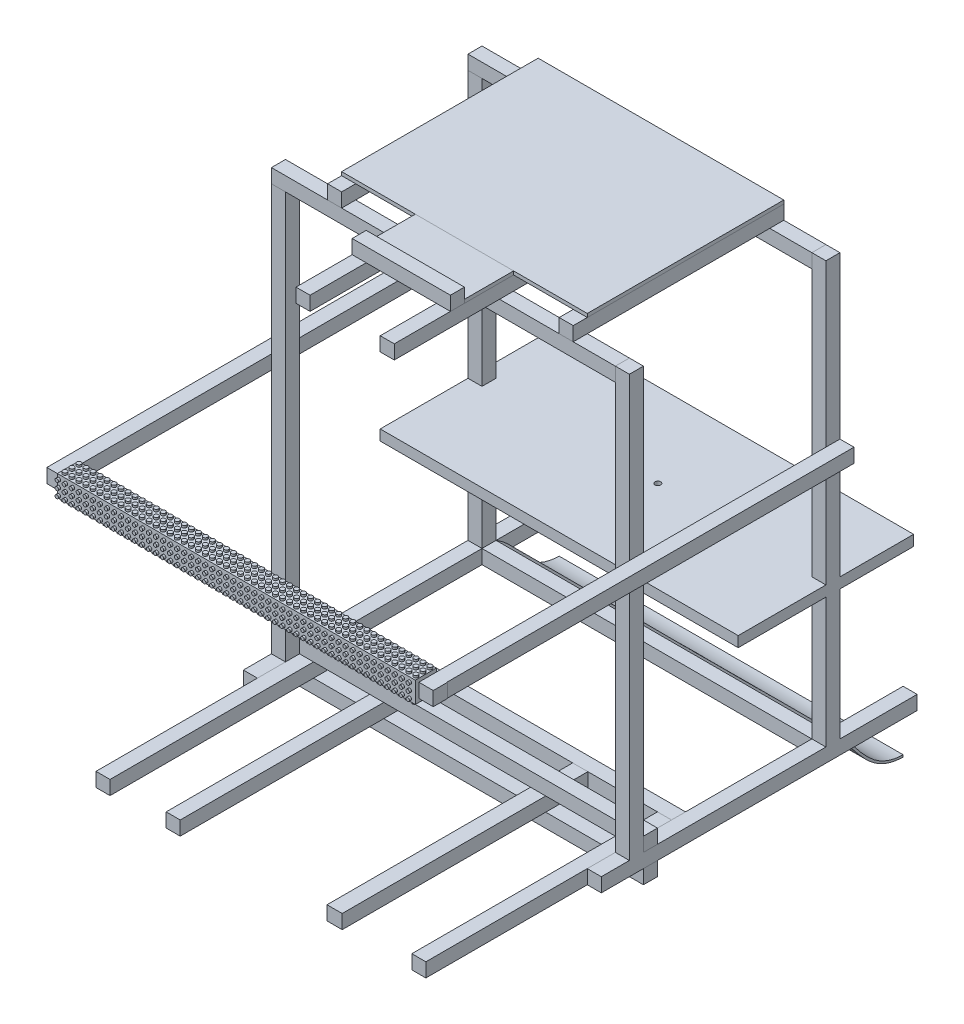
from build123d import *

# Parameters (mm, degrees)
SKETCH1_W                  = 20
SKETCH1_H                  = 20
BOSS_EXTRUDE1_DEPTH        = 450
BOSS_EXTRUDE1_2_DEPTH      = 450
SKETCH3_W                  = 20
SKETCH3_H                  = 20
BOSS_EXTRUDE2_DEPTH        = 600
BOSS_EXTRUDE2_2_DEPTH      = 600
SKETCH5_W                  = 20
SKETCH5_H                  = 20
BOSS_EXTRUDE3_DEPTH        = 600
SKETCH6_W                  = 20
SKETCH6_H                  = 20
BOSS_EXTRUDE4_DEPTH        = 470
SKETCH7_W                  = 20
SKETCH7_H                  = 20
BOSS_EXTRUDE5_DEPTH        = 350
SKETCH7_W_2                = 21.587597794
BOSS_EXTRUDE5_2_DEPTH      = 350
BOSS_EXTRUDE5_3_DEPTH      = 350
BOSS_EXTRUDE5_4_DEPTH      = 350
SKETCH8_W                  = 20
SKETCH8_H                  = 20
BOSS_EXTRUDE6_DEPTH        = 470
BOSS_EXTRUDE7_DEPTH        = 500
BOSS_EXTRUDE7_DEPTH_BACK   = 10
SKETCH9_W                  = 20
SKETCH9_H                  = 20
BOSS_EXTRUDE7_2_DEPTH      = 500
BOSS_EXTRUDE7_2_DEPTH_BACK = 10
SKETCH10_W                 = 20
SKETCH10_H                 = 20
BOSS_EXTRUDE9_DEPTH        = 490
BOSS_EXTRUDE9_2_DEPTH      = 490
SKETCH11_W                 = 20
SKETCH11_H                 = 20
BOSS_EXTRUDE10_DEPTH       = 300
BOSS_EXTRUDE10_2_DEPTH     = 300
SKETCH11_3_W               = 20
SKETCH11_3_H               = 20
BOSS_EXTRUDE11_DEPTH       = 450
BOSS_EXTRUDE11_2_DEPTH     = 450
SKETCH12_W                 = 20
SKETCH12_H                 = 20
BOSS_EXTRUDE12_DEPTH       = 140
SKETCH13_W                 = 20
SKETCH13_H                 = 20
BOSS_EXTRUDE13_DEPTH       = 600
BOSS_EXTRUDE13_2_DEPTH     = 600
SKETCH14_W                 = 70
SKETCH14_H                 = 5
BOSS_EXTRUDE14_DEPTH       = 140
SKETCH16_W                 = 350
SKETCH16_H                 = 5
BOSS_EXTRUDE15_DEPTH       = 280
SKETCH18_R                 = 5
CUT_EXTRUDE1_DEPTH         = 20
BOSS_EXTRUDE17_DEPTH       = 490
BOSS_EXTRUDE18_START       = -510
SKETCH23_W                 = 250
SKETCH23_H                 = 15
BOSS_EXTRUDE18_DEPTH       = 510
SKETCH24_R                 = 4
CUT_EXTRUDE2_DEPTH         = 15
SKETCH25_W                 = 550.536988499
SKETCH25_H                 = 20
BOSS_EXTRUDE19_DEPTH       = 20
SKETCH26_W                 = 30
SKETCH26_H                 = 30
SKETCH26_W_2               = 20
SKETCH26_H_2               = 20
BOSS_EXTRUDE20_DEPTH       = 510
SKETCH27_R                 = 2.31294086
BOSS_EXTRUDE21_DEPTH       = 4
LPATTERN1_COUNT            = 51
LPATTERN1_PITCH            = 10
LPATTERN1_COUNT_DIR2       = 3
LPATTERN1_PITCH_DIR2       = 10
SKETCH28_R                 = 2.456929174
BOSS_EXTRUDE22_DEPTH       = 3
LPATTERN2_COUNT            = 51
LPATTERN2_PITCH            = 10
LPATTERN2_COUNT_DIR2       = 3
LPATTERN2_PITCH_DIR2       = 10
SKETCH29_R                 = 3.057744685
BOSS_EXTRUDE23_DEPTH       = 3
LPATTERN3_COUNT            = 51
LPATTERN3_PITCH            = 10
LPATTERN3_COUNT_DIR2       = 3
LPATTERN3_PITCH_DIR2       = 10


with BuildPart() as part:
    # Sketch1 → Boss-Extrude1 (new body)
    with BuildSketch(Plane.XY):
        Rectangle(SKETCH1_W, SKETCH1_H)
    extrude(amount=BOSS_EXTRUDE1_DEPTH)

    # Sketch18 → Cut-Extrude1 (cut)
    with BuildSketch(Plane.ZY.offset(10)):
        with Locations(Location((30, -4.6, 0), (0, 0, 270))):
            Circle(SKETCH18_R)
    extrude(amount=-CUT_EXTRUDE1_DEPTH, mode=Mode.SUBTRACT)



with BuildPart() as body_2:
    # Sketch1 → Boss-Extrude1 2 (new body)
    with BuildSketch(Plane.XY):
        with Locations((490, 0)):
            Rectangle(SKETCH1_W, SKETCH1_H)
    extrude(amount=BOSS_EXTRUDE1_2_DEPTH)

    # Sketch5 → Boss-Extrude3 (add)
    with BuildSketch(Plane(origin=(0, 10, 0), x_dir=(1, 0, 0), z_dir=(0, 1, 0))):
        with Locations((490, -400)):
            Rectangle(SKETCH5_W, SKETCH5_H)
        with Locations((490, -120)):
            Rectangle(SKETCH5_W, SKETCH5_H)
    extrude(amount=BOSS_EXTRUDE3_DEPTH)


with BuildPart() as body_3:
    # Sketch3 → Boss-Extrude2 (new body)
    with BuildSketch(Plane(origin=(0, 10, 0), x_dir=(1, 0, 0), z_dir=(0, 1, 0))):
        with Locations((0, -400)):
            Rectangle(SKETCH3_W, SKETCH3_H)
    extrude(amount=BOSS_EXTRUDE2_DEPTH)


with BuildPart() as body_4:
    # Sketch3 → Boss-Extrude2 2 (new body)
    with BuildSketch(Plane(origin=(0, 10, 0), x_dir=(1, 0, 0), z_dir=(0, 1, 0))):
        with Locations((0, -120)):
            Rectangle(SKETCH3_W, SKETCH3_H)
    extrude(amount=BOSS_EXTRUDE2_2_DEPTH)


with BuildPart() as body_5:
    # Sketch6 → Boss-Extrude4 (new body)
    with BuildSketch(Plane.ZY.offset(-480)):
        with Locations((320, 0)):
            Rectangle(SKETCH6_W, SKETCH6_H)
    extrude(amount=BOSS_EXTRUDE4_DEPTH)


with BuildPart() as body_6:
    # Sketch7 → Boss-Extrude5 (new body)
    with BuildSketch(Plane.XY.offset(330)):
        with Locations((470, 0)):
            Rectangle(SKETCH7_W, SKETCH7_H)
    extrude(amount=BOSS_EXTRUDE5_DEPTH)


with BuildPart() as body_7:
    # Sketch7 → Boss-Extrude5 2 (new body)
    with BuildSketch(Plane.XY.offset(330)):
        with Locations((350, 0)):
            Rectangle(SKETCH7_W_2, SKETCH7_H)
    extrude(amount=BOSS_EXTRUDE5_2_DEPTH)


with BuildPart() as body_8:
    # Sketch7 → Boss-Extrude5 3 (new body)
    with BuildSketch(Plane.XY.offset(330)):
        with Locations((120, 0)):
            Rectangle(SKETCH7_W, SKETCH7_H)
    extrude(amount=BOSS_EXTRUDE5_3_DEPTH)


with BuildPart() as body_9:
    # Sketch7 → Boss-Extrude5 4 (new body)
    with BuildSketch(Plane.XY.offset(330)):
        with Locations((20, 0)):
            Rectangle(SKETCH7_W, SKETCH7_H)
    extrude(amount=BOSS_EXTRUDE5_4_DEPTH)


with BuildPart() as body_10:
    # Sketch8 → Boss-Extrude6 (new body)
    with BuildSketch(Plane.ZY.offset(-480)):
        with Locations((120, 0)):
            Rectangle(SKETCH8_W, SKETCH8_H)
    extrude(amount=BOSS_EXTRUDE6_DEPTH)


with BuildPart() as body_11:
    # Sketch9 → Boss-Extrude7 (new, two sides: drawn at the far end of the back side and taken through both)
    with BuildSketch(Plane(origin=(0, 0, 0), x_dir=(0, 0, -1), z_dir=(1, 0, 0)).offset(-BOSS_EXTRUDE7_DEPTH_BACK)):
        with Locations((-380, 20)):
            Rectangle(SKETCH9_W, SKETCH9_H)
    extrude(amount=BOSS_EXTRUDE7_DEPTH + BOSS_EXTRUDE7_DEPTH_BACK)


with BuildPart() as body_12:
    # Sketch9 → Boss-Extrude7 2 (new, two sides: drawn at the far end of the back side and taken through both)
    with BuildSketch(Plane(origin=(0, 0, 0), x_dir=(0, 0, -1), z_dir=(1, 0, 0)).offset(-BOSS_EXTRUDE7_2_DEPTH_BACK)):
        with Locations((-380, -20)):
            Rectangle(SKETCH9_W, SKETCH9_H)
    extrude(amount=BOSS_EXTRUDE7_2_DEPTH + BOSS_EXTRUDE7_2_DEPTH_BACK)


with BuildPart() as body_13:
    # Sketch10 → Boss-Extrude9 (new body)
    with BuildSketch(Plane.ZY.offset(-480)):
        with Locations((400, 600)):
            Rectangle(SKETCH10_W, SKETCH10_H)
    extrude(amount=BOSS_EXTRUDE9_DEPTH)


with BuildPart() as body_14:
    # Sketch10 → Boss-Extrude9 2 (new body)
    with BuildSketch(Plane.ZY.offset(-480)):
        with Locations((120, 600)):
            Rectangle(SKETCH10_W, SKETCH10_H)
    extrude(amount=BOSS_EXTRUDE9_2_DEPTH)


with BuildPart() as body_15:
    # Sketch11 → Boss-Extrude10 (new body)
    with BuildSketch(Plane(origin=(0, 0, 110), x_dir=(-1, 0, 0), z_dir=(0, 0, -1))):
        with Locations((-80, 620)):
            Rectangle(SKETCH11_W, SKETCH11_H)
    extrude(amount=-BOSS_EXTRUDE10_DEPTH)


with BuildPart() as body_16:
    # Sketch11 → Boss-Extrude10 2 (new body)
    with BuildSketch(Plane(origin=(0, 0, 110), x_dir=(-1, 0, 0), z_dir=(0, 0, -1))):
        with Locations((-410, 620)):
            Rectangle(SKETCH11_W, SKETCH11_H)
    extrude(amount=-BOSS_EXTRUDE10_2_DEPTH)


with BuildPart() as body_17:
    # Sketch11<3> → Boss-Extrude11 (new body)
    with BuildSketch(Plane(origin=(0, 0, 110), x_dir=(-1, 0, 0), z_dir=(0, 0, -1))):
        with Locations((-305, 620)):
            Rectangle(SKETCH11_3_W, SKETCH11_3_H)
    extrude(amount=-BOSS_EXTRUDE11_DEPTH)


with BuildPart() as body_18:
    # Sketch11<3> → Boss-Extrude11 2 (new body)
    with BuildSketch(Plane(origin=(0, 0, 110), x_dir=(-1, 0, 0), z_dir=(0, 0, -1))):
        with Locations((-185, 620)):
            Rectangle(SKETCH11_3_W, SKETCH11_3_H)
    extrude(amount=-BOSS_EXTRUDE11_2_DEPTH)


with BuildPart() as body_19:
    # Sketch12 → Boss-Extrude12 (new body)
    with BuildSketch(Plane(origin=(315, 0, 0), x_dir=(0, 0, -1), z_dir=(1, 0, 0))):
        with Locations((-470, 640)):
            Rectangle(SKETCH12_W, SKETCH12_H)
    extrude(amount=-BOSS_EXTRUDE12_DEPTH)


with BuildPart() as body_20:
    # Sketch13 → Boss-Extrude13 (new body)
    with BuildSketch(Plane(origin=(0, 0, 110), x_dir=(-1, 0, 0), z_dir=(0, 0, -1))):
        with Locations((20, 370)):
            Rectangle(SKETCH13_W, SKETCH13_H)
    extrude(amount=-BOSS_EXTRUDE13_DEPTH)



with BuildPart() as body_21:
    # Sketch13 → Boss-Extrude13 2 (new body)
    with BuildSketch(Plane(origin=(0, 0, 110), x_dir=(-1, 0, 0), z_dir=(0, 0, -1))):
        with Locations((-510, 370)):
            Rectangle(SKETCH13_W, SKETCH13_H)
    extrude(amount=-BOSS_EXTRUDE13_2_DEPTH)


with BuildPart() as body_22:
    # Sketch14 → Boss-Extrude14 (new body)
    with BuildSketch(Plane.ZY.offset(-175)):
        with Locations((425, 632.5)):
            Rectangle(SKETCH14_W, SKETCH14_H)
    extrude(amount=-BOSS_EXTRUDE14_DEPTH)


with BuildPart() as body_23:
    # Sketch16 → Boss-Extrude15 (new body)
    with BuildSketch(Plane(origin=(0, 0, 110), x_dir=(-1, 0, 0), z_dir=(0, 0, -1))):
        with Locations((-245, 632.5)):
            Rectangle(SKETCH16_W, SKETCH16_H)
    extrude(amount=-BOSS_EXTRUDE15_DEPTH)


with BuildPart() as part_1:
    add(part.part)

    add(body_2.part)  # Boss-Extrude17 merges body 2

    add(body_4.part)  # Boss-Extrude17 merges body 4

    add(body_10.part)  # Boss-Extrude17 merges body 10
    # Sketch21 → Boss-Extrude17 (add)
    with BuildSketch(Plane.ZY.offset(10)):
        with BuildLine():
            Line((0, -74.5), (0.064786716, -77.499300365))
            add(Edge.make_bspline(
                [(111.507607277, 7.406330727), (109.029339629, 5.965802292), (104.232292235, 2.784144258), (95.402484971, -4.467266683), (85.404811463, -14.977489125), (74.292532955, -28.856232059), (63.202619863, -42.930592911), (53.224044503, -53.913775199), (44.320108161, -61.685272519), (37.062940716, -66.853311647), (29.115882011, -71.20138135), (21.838341212, -74.005276933), (15.581751093, -75.678603579), (10.664256349, -76.630634467), (6.365051959, -77.157271334), (2.812704626, -77.410150216), (0.976168272, -77.479613968), (0.064786716, -77.499300365)],
                knots=[0, 0, 0, 0, 0.0625, 0.125, 0.25, 0.375, 0.5, 0.625, 0.6875, 0.75, 0.8125, 0.875, 0.90625, 0.9375, 0.96875, 0.984375, 1, 1, 1, 1], degree=3))
            Line((111.507607277, 7.406330727), (110, 10))
            add(Edge.make_bspline(
                [(110, 10), (68.460581431, -14.145379809), (56.913306473, -73.270637884), (0, -74.5)],
                knots=[0, 0, 0, 0, 1, 1, 1, 1], degree=3))
        make_face()
    extrude(amount=-BOSS_EXTRUDE17_DEPTH)

    # Sketch23 → Boss-Extrude18 (add)
    with BuildSketch(Plane(origin=(500, 0, 0), x_dir=(0, 0, -1), z_dir=(1, 0, 0)).offset(BOSS_EXTRUDE18_START)):
        with Locations((-130, 202.5)):
            Rectangle(SKETCH23_W, SKETCH23_H)
    extrude(amount=BOSS_EXTRUDE18_DEPTH)

    # Sketch24 → Cut-Extrude2 (cut)
    with BuildSketch(Plane(origin=(0, 210, 0), x_dir=(1, 0, 0), z_dir=(0, 1, 0))):
        with Locations(Location((255, -124.362898022, 0), (0, 0, 270))):
            Circle(SKETCH24_R)
    extrude(amount=-CUT_EXTRUDE2_DEPTH, mode=Mode.SUBTRACT)


with BuildPart() as body_20_1:
    add(body_20.part)

    add(body_21.part)  # Boss-Extrude19 merges body 21
    # Sketch25 → Boss-Extrude19 (add)
    with BuildSketch(Plane(origin=(0, 380, 0), x_dir=(1, 0, 0), z_dir=(0, 1, 0))):
        with Locations((245.26849425, -700)):
            Rectangle(SKETCH25_W, SKETCH25_H)
    extrude(amount=-BOSS_EXTRUDE19_DEPTH)

    # Sketch26 → Boss-Extrude20 (add)
    with BuildSketch(Plane(origin=(-10, 0, 0), x_dir=(0, 0, -1), z_dir=(1, 0, 0))):
        with Locations((-700, 370)):
            Rectangle(SKETCH26_W, SKETCH26_H)
        with Locations((-700, 370)):
            Rectangle(SKETCH26_W_2, SKETCH26_H_2, mode=Mode.SUBTRACT)
    extrude(amount=BOSS_EXTRUDE20_DEPTH)

    # Sketch27 → Boss-Extrude21 (add)
    with BuildSketch(Plane.XZ.offset(-355)):
        with Locations(Location((-6.688761577, 710.020375004, 0), (0, 0, 180))):
            Circle(SKETCH27_R)
    boss_extrude21 = extrude(amount=BOSS_EXTRUDE21_DEPTH)

    # LPattern1: Boss-Extrude21 51 × 3
    with Locations(*[(i * LPATTERN1_PITCH, 0, -j * LPATTERN1_PITCH_DIR2) for i in range(LPATTERN1_COUNT) for j in range(LPATTERN1_COUNT_DIR2) if (i, j) != (0, 0)]):
        add(boss_extrude21)

    # Sketch28 → Boss-Extrude22 (add)
    with BuildSketch(Plane.XY.offset(715)):
        with Locations(Location((492.109632983, 378.860283748, 0), (0, 0, 180))):
            Circle(SKETCH28_R)
    boss_extrude22 = extrude(amount=BOSS_EXTRUDE22_DEPTH)

    # LPattern2: Boss-Extrude22 51 × 3
    with Locations(*[(-i * LPATTERN2_PITCH, -j * LPATTERN2_PITCH_DIR2, 0) for i in range(LPATTERN2_COUNT) for j in range(LPATTERN2_COUNT_DIR2) if (i, j) != (0, 0)]):
        add(boss_extrude22)

    # Sketch29 → Boss-Extrude23 (add)
    with BuildSketch(Plane(origin=(0, 385, 0), x_dir=(1, 0, 0), z_dir=(0, 1, 0))):
        with Locations((495.605384483, -689.752353468)):
            Circle(SKETCH29_R)
    boss_extrude23 = extrude(amount=BOSS_EXTRUDE23_DEPTH)

    # LPattern3: Boss-Extrude23 51 × 3
    with Locations(*[(-i * LPATTERN3_PITCH, 0, j * LPATTERN3_PITCH_DIR2) for i in range(LPATTERN3_COUNT) for j in range(LPATTERN3_COUNT_DIR2) if (i, j) != (0, 0)]):
        add(boss_extrude23)


solid = Compound([body_3.part, body_5.part, body_6.part, body_7.part, body_8.part, body_9.part, body_11.part, body_12.part, body_13.part, body_14.part, body_15.part, body_16.part, body_17.part, body_18.part, body_19.part, body_22.part, body_23.part, part_1.part, body_20_1.part])
